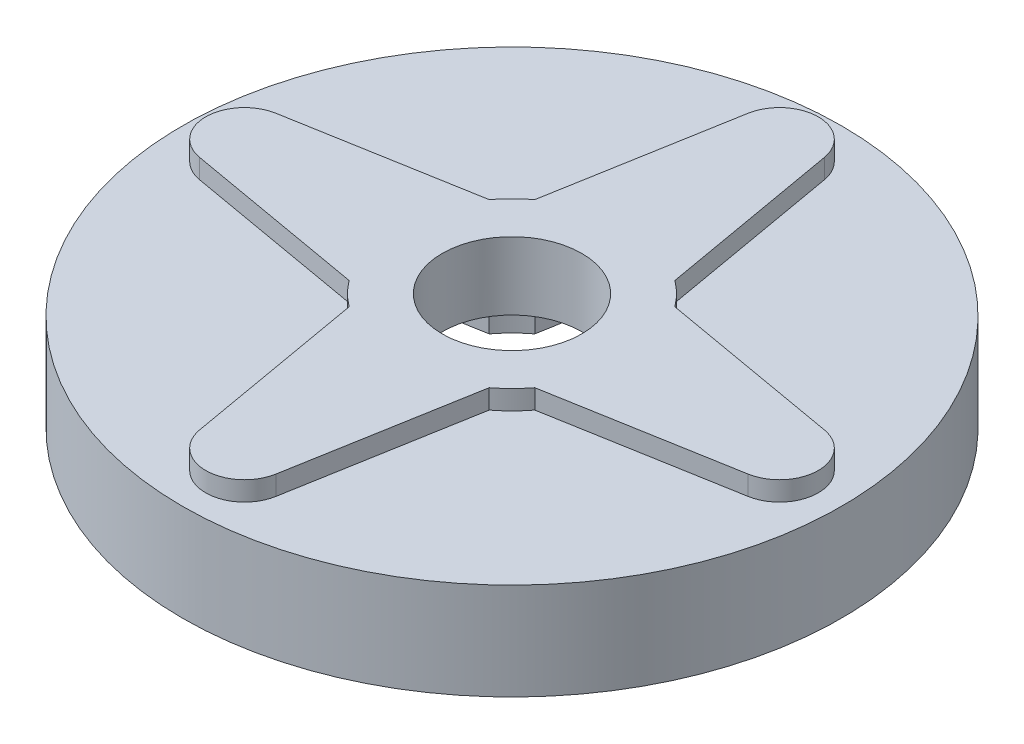
from build123d import *

# Parameters (mm, degrees)
SKETCH1_R           = 21.59
BOSS_EXTRUDE1_DEPTH = 6.35
SKETCH2_R           = 4.572
CUT_EXTRUDE1_DEPTH  = 32.186194061
SKETCH3_R           = 4.572
CUT_EXTRUDE2_DEPTH  = 3.175
SKETCH4_R           = 4.572
BOSS_EXTRUDE2_DEPTH = 1.27


with BuildPart() as part:
    # Sketch1 → Boss-Extrude1 (new body)
    with BuildSketch(Plane(origin=(0, 0, 0), x_dir=(1, 0, 0), z_dir=(0, 1, 0))):
        Circle(SKETCH1_R)
    extrude(amount=BOSS_EXTRUDE1_DEPTH)

    # Sketch2 → Cut-Extrude1 (cut, through all)
    with BuildSketch(Plane.XZ):
        Circle(SKETCH2_R)
    extrude(amount=-CUT_EXTRUDE1_DEPTH, mode=Mode.SUBTRACT)

    # Sketch3 → Cut-Extrude2 (cut)
    with BuildSketch(Plane.XZ):
        with BuildLine():
            Line((-17.965218605, -2.5017368), (-6.084250168, -4.587624646))
            ThreePointArc((-6.084250168, -4.587624646), (-5.388153673, -5.388153673), (-4.587624646, -6.084250168))
            Line((-4.587624646, -6.084250168), (-2.5017368, -17.965218605))
            ThreePointArc((-2.5017368, -17.965218605), (0, -20.066), (2.5017368, -17.965218605))
            Line((2.5017368, -17.965218605), (4.587624646, -6.084250168))
            ThreePointArc((4.587624646, -6.084250168), (5.388153673, -5.388153673), (6.084250168, -4.587624646))
            Line((6.084250168, -4.587624646), (17.965218605, -2.5017368))
            ThreePointArc((17.965218605, -2.5017368), (20.066, 0), (17.965218605, 2.5017368))
            Line((17.965218605, 2.5017368), (6.084250168, 4.587624646))
            ThreePointArc((6.084250168, 4.587624646), (5.388153673, 5.388153673), (4.587624646, 6.084250168))
            Line((4.587624646, 6.084250168), (2.5017368, 17.965218605))
            ThreePointArc((2.5017368, 17.965218605), (0, 20.066), (-2.5017368, 17.965218605))
            Line((-2.5017368, 17.965218605), (-4.587624646, 6.084250168))
            ThreePointArc((-4.587624646, 6.084250168), (-5.388153673, 5.388153673), (-6.084250168, 4.587624646))
            Line((-6.084250168, 4.587624646), (-17.965218605, 2.5017368))
            ThreePointArc((-17.965218605, 2.5017368), (-20.066, 0), (-17.965218605, -2.5017368))
        make_face()
        Circle(SKETCH3_R, mode=Mode.SUBTRACT)
    extrude(amount=-CUT_EXTRUDE2_DEPTH, mode=Mode.SUBTRACT)

    # Sketch4 → Boss-Extrude2 (add)
    with BuildSketch(Plane(origin=(0, 6.35, 0), x_dir=(1, 0, 0), z_dir=(0, 1, 0))):
        with BuildLine():
            Line((2.5017368, -17.965218605), (4.587624646, -6.084250168))
            ThreePointArc((4.587624646, -6.084250168), (5.388153673, -5.388153673), (6.084250168, -4.587624646))
            Line((6.084250168, -4.587624646), (17.965218605, -2.5017368))
            ThreePointArc((17.965218605, -2.5017368), (20.066, 0), (17.965218605, 2.5017368))
            Line((17.965218605, 2.5017368), (6.084250168, 4.587624646))
            ThreePointArc((6.084250168, 4.587624646), (5.388153673, 5.388153673), (4.587624646, 6.084250168))
            Line((4.587624646, 6.084250168), (2.5017368, 17.965218605))
            ThreePointArc((2.5017368, 17.965218605), (0, 20.066), (-2.5017368, 17.965218605))
            Line((-2.5017368, 17.965218605), (-4.587624646, 6.084250168))
            ThreePointArc((-4.587624646, 6.084250168), (-5.388153673, 5.388153673), (-6.084250168, 4.587624646))
            Line((-6.084250168, 4.587624646), (-17.965218605, 2.5017368))
            ThreePointArc((-17.965218605, 2.5017368), (-20.066, 0), (-17.965218605, -2.5017368))
            Line((-17.965218605, -2.5017368), (-6.084250168, -4.587624646))
            ThreePointArc((-6.084250168, -4.587624646), (-5.388153673, -5.388153673), (-4.587624646, -6.084250168))
            Line((-4.587624646, -6.084250168), (-2.5017368, -17.965218605))
            ThreePointArc((-2.5017368, -17.965218605), (0, -20.066), (2.5017368, -17.965218605))
        make_face()
        Circle(SKETCH4_R, mode=Mode.SUBTRACT)
    extrude(amount=BOSS_EXTRUDE2_DEPTH)


solid = part.part
